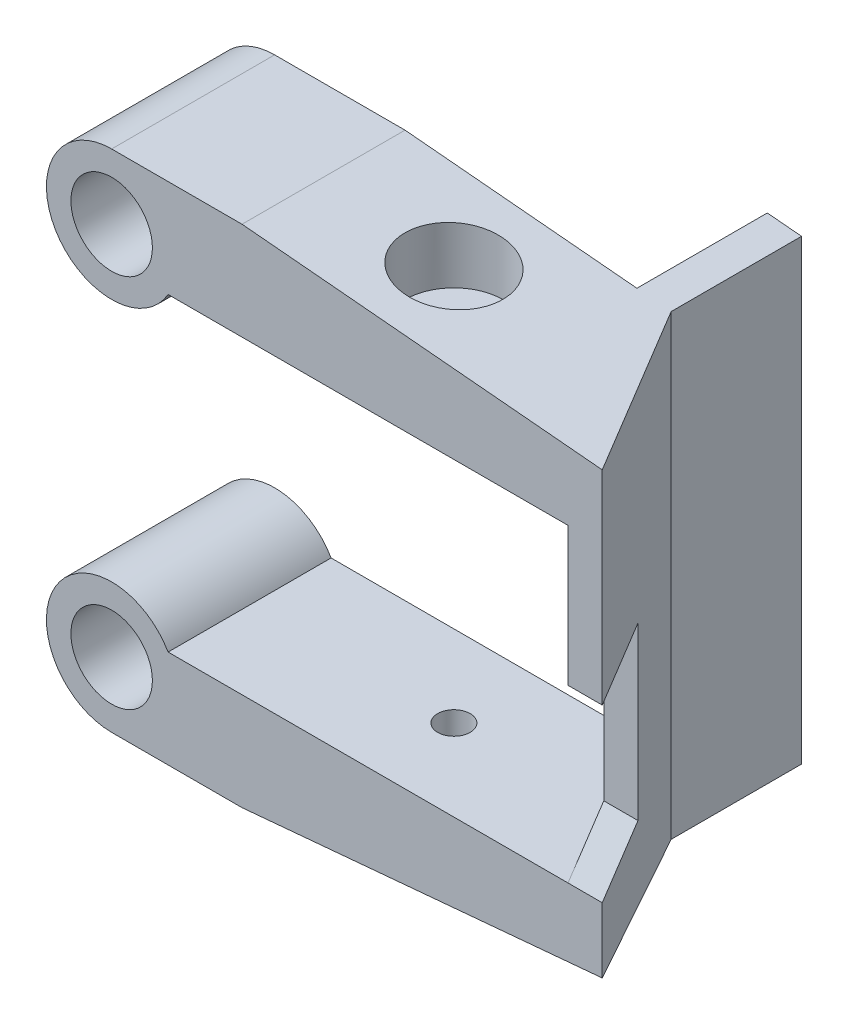
from build123d import *

# Parameters (mm, degrees)
CROQUIS1_R              = 2.5
SALIENTE_EXTRUIR1_DEPTH = 10
CROQUIS2_R              = 1
CORTAR_EXTRUIR1_DEPTH   = 4
CROQUIS3_R              = 3
CORTAR_EXTRUIR2_DEPTH   = 2
SALIENTE_EXTRUIR2_DEPTH = 13.5
SALIENTE_EXTRUIR3_START = 2
CROQUIS6_R              = 3
SALIENTE_EXTRUIR3_DEPTH = 2
CORTAR_EXTRUIR3_DEPTH   = 10
SALIENTE_EXTRUIR4_DEPTH = 8
CORTAR_EXTRUIR4_START   = 25.003066482
CORTAR_EXTRUIR4_DEPTH   = 5.096933518
CORTAR_EXTRUIR5_DEPTH   = 1


# Read off the part's stored shape, not the designer's step: Cortar-Extruir4
with BuildPart() as part:
    # Croquis1 → Saliente-Extruir1 (new body)
    with BuildSketch(Plane.XY):
        with BuildLine():
            Line((3.464101615, 3.5), (28, 3.5))
            Line((28, 3.5), (28, -0.5))
            Line((28, -0.5), (6, -0.5))
            Line((6, -0.5), (6, -2.5))
            Line((6, -2.5), (0, -2.5))
            ThreePointArc((0, -2.5), (-3.464101615, 3.5), (3.464101615, 3.5))
        make_face()
        with Locations((0, 1.5)):
            Circle(CROQUIS1_R, mode=Mode.SUBTRACT)
    extrude(amount=SALIENTE_EXTRUIR1_DEPTH)

    # Croquis2 → Cortar-Extruir1 (cut)
    with BuildSketch(Plane.XZ.offset(0.5)):
        with Locations(Location((16, 5, 0), (0, 0, 270))):
            Circle(CROQUIS2_R)
        Polygon((28, 10), (22.226497308, 0), (28, 0), align=None)
    extrude(amount=-CORTAR_EXTRUIR1_DEPTH, mode=Mode.SUBTRACT)

    # Croquis3 → Cortar-Extruir2 (cut)
    with BuildSketch(Plane.XZ.offset(0.5)):
        with Locations(Location((16, 5, 0), (0, 0, 270))):
            Circle(CROQUIS3_R)
    extrude(amount=-CORTAR_EXTRUIR2_DEPTH, mode=Mode.SUBTRACT)

    # Croquis4 → Saliente-Extruir2 (add)
    with BuildSketch(Plane.XZ.offset(0.5)):
        Polygon((28, 10), (30.1, 10), (24.326497308, 0), (22.226497308, 0), align=None)
    extrude(amount=-SALIENTE_EXTRUIR2_DEPTH)

    # Croquis6 → Saliente-Extruir3 (add)
    with BuildSketch(Plane.XZ.offset(0.5).offset(SALIENTE_EXTRUIR3_START)):
        Polygon((6, 10), (6, 0), (24.326497308, 0), (30.1, 10), align=None)
        with Locations(Location((16, 5, 0), (0, 0, 270))):
            Circle(CROQUIS6_R, mode=Mode.SUBTRACT)
    extrude(amount=-SALIENTE_EXTRUIR3_DEPTH)

    # Croquis7 → Cortar-Extruir3 (cut)
    with BuildSketch(Plane.XY.offset(10)):
        Polygon((30.1, -0.5), (8, -2.5), (30.1, -2.5), align=None)
    extrude(amount=-CORTAR_EXTRUIR3_DEPTH, mode=Mode.SUBTRACT)

    # Croquis8 → Saliente-Extruir4 (add)
    with BuildSketch(Plane(origin=(0, 0, 0), x_dir=(-1, 0, 0), z_dir=(0, 0, -1))):
        Polygon((-22.226497308, 13), (-24.326497308, 13), (-24.326497308, -1.022488931), (-22.226497308, -1.21253418), align=None)
    extrude(amount=SALIENTE_EXTRUIR4_DEPTH)

    # Simetría1: part across plane


with BuildPart() as part_1:
    add(part.part)
    add(part.part.mirror(Plane.ZX.offset(13)))

    # Cortar-Extruir4 outline → Cortar-Extruir4 (cut)
    with BuildSketch(Plane.YZ.offset(CORTAR_EXTRUIR4_START)):
        Polygon((3.771215703, 4.80915888), (14.271215703, 4.80915888), (14, 10), (3.5, 10), align=None)
    extrude(amount=CORTAR_EXTRUIR4_DEPTH, mode=Mode.SUBTRACT)

    # Croquis10 → Cortar-Extruir5 (cut)
    # profile 1 of 3: a face of its own
    with BuildSketch(Plane.XZ.offset(2.5)):
        with BuildLine():
            Line((0.93893851, 8.061465511), (0.624835946, 8.061465511))
            add(Edge.make_bspline(
                [(0.624835946, 8.061465511), (0.629974339, 8.091008734), (0.640098474, 8.149217504), (0.663168518, 8.233619406), (0.693890136, 8.31334783), (0.729855851, 8.389374725), (0.77397113, 8.460341308), (0.823569151, 8.527515757), (0.881199455, 8.589213597), (0.943781652, 8.647142725), (1.011267113, 8.699749333), (1.083372869, 8.74442066), (1.157885638, 8.783469404), (1.235775022, 8.815163541), (1.31697886, 8.838710682), (1.400592637, 8.85642678), (1.48740102, 8.867224), (1.54631294, 8.868506113), (1.576258221, 8.869157819)],
                knots=[0, 0, 0, 0, 1.053304757, 2.075317675, 3.068179183, 4.052514018, 5.025721787, 5.999656851, 6.981831287, 7.987213101, 8.994102963, 9.982949043, 10.963611807, 11.947192756, 12.931972798, 13.930523328, 14.948072636, 16, 16, 16, 16], degree=3))
            add(Edge.make_bspline(
                [(1.576258221, 8.869157819), (1.607849412, 8.868337596), (1.669858711, 8.866727609), (1.760664018, 8.85442526), (1.84726396, 8.835237206), (1.929477522, 8.806775963), (2.007089599, 8.770284416), (2.080961345, 8.72633159), (2.150619484, 8.674519652), (2.21443137, 8.614026389), (2.273438454, 8.548590787), (2.325098871, 8.477592336), (2.367371584, 8.401308099), (2.404054713, 8.321765516), (2.431060952, 8.236909756), (2.450848297, 8.147774097), (2.461883194, 8.05402824), (2.463669481, 7.990211824), (2.464579535, 7.957699485)],
                knots=[0, 0, 0, 0, 1.062315377, 2.085183558, 3.076853664, 4.041450855, 5.005054491, 5.956881831, 6.928532668, 7.918549963, 8.909565511, 9.889228988, 10.864308296, 11.838912148, 12.830831495, 13.853185998, 14.906269772, 16, 16, 16, 16], degree=3))
            add(Edge.make_bspline(
                [(2.464579535, 7.957699485), (2.463116795, 7.915300966), (2.460274509, 7.832915369), (2.437793048, 7.714206426), (2.399556512, 7.605209763), (2.354841164, 7.522096328), (2.310374191, 7.460727421), (2.271557279, 7.415828038), (2.227393375, 7.371636324), (2.177390877, 7.328856679), (2.121657913, 7.287495806), (2.060599984, 7.247148694), (1.99461627, 7.206562654), (1.947553936, 7.182191469), (1.92331351, 7.169638588)],
                knots=[0, 0, 0, 0, 1.499598844, 2.913907084, 4.255683563, 5.573052951, 6.236393449, 6.934250511, 7.671053759, 8.445154725, 9.260560518, 10.125260916, 11.034376938, 12, 12, 12, 12], degree=3))
            add(Edge.make_bspline(
                [(1.92331351, 7.169638588), (1.959233109, 7.145233398), (2.029395336, 7.097562418), (2.121912212, 7.013455328), (2.199538538, 6.921370005), (2.264524206, 6.822750081), (2.313572277, 6.715412989), (2.34974653, 6.60110216), (2.370969298, 6.478884654), (2.373528778, 6.394981352), (2.374835946, 6.352130575)],
                knots=[0, 0, 0, 0, 1.064624726, 2.079545519, 3.056122326, 4.013672591, 4.968126873, 5.942090367, 6.948992187, 8, 8, 8, 8], degree=3))
            add(Edge.make_bspline(
                [(2.374835946, 6.352130575), (2.372951048, 6.300812434), (2.36922834, 6.199458148), (2.339403877, 6.050347696), (2.290644048, 5.907158178), (2.223486846, 5.770520785), (2.138635562, 5.643878593), (2.038496205, 5.529007813), (1.922317264, 5.428948838), (1.792905422, 5.343764731), (1.653463441, 5.275250986), (1.506916129, 5.225768888), (1.354806806, 5.195153842), (1.251313153, 5.191510381), (1.199054696, 5.189670639)],
                knots=[0, 0, 0, 0, 1.004874671, 1.984646221, 2.966438109, 3.961709977, 4.958676373, 5.945134406, 6.938497793, 7.953256374, 8.973116323, 9.973725145, 10.976845487, 12, 12, 12, 12], degree=3))
            add(Edge.make_bspline(
                [(1.199054696, 5.189670639), (1.165832854, 5.190507601), (1.100573883, 5.192151679), (1.004559463, 5.204274263), (0.91247804, 5.224446776), (0.824180744, 5.253411912), (0.739975204, 5.290705099), (0.659339856, 5.335857332), (0.582972319, 5.389378235), (0.510561471, 5.450257408), (0.444148699, 5.518902365), (0.38427227, 5.594281029), (0.331495652, 5.67602942), (0.285883283, 5.764111158), (0.247186821, 5.858136921), (0.216630047, 5.958748464), (0.191662112, 6.065265565), (0.181374125, 6.13911863), (0.176117997, 6.176850126)],
                knots=[0, 0, 0, 0, 1.015592156, 1.994967694, 2.953714725, 3.89374535, 4.831137841, 5.76533834, 6.714853956, 7.678276274, 8.653576723, 9.630054425, 10.617115938, 11.623871201, 12.658910274, 13.721192194, 14.835758172, 16, 16, 16, 16], degree=3))
            Line((0.176117997, 6.176850126), (0.490220561, 6.176850126))
            add(Edge.make_bspline(
                [(0.490220561, 6.176850126), (0.497040066, 6.137680467), (0.509892115, 6.063861265), (0.538014089, 5.961531168), (0.570954337, 5.873556315), (0.611701031, 5.799048393), (0.661176422, 5.735216424), (0.719783483, 5.679156323), (0.788329897, 5.628889807), (0.864972279, 5.584979951), (0.947647633, 5.548083284), (1.034249656, 5.523879086), (1.122141028, 5.506036602), (1.181668268, 5.504531765), (1.211674888, 5.503773203)],
                knots=[0, 0, 0, 0, 1.310091687, 2.469000878, 3.493463796, 4.400459837, 5.257309936, 6.145490497, 7.065451012, 8.052643887, 9.053215749, 10.040649124, 11.012326184, 12, 12, 12, 12], degree=3))
            add(Edge.make_bspline(
                [(1.211674888, 5.503773203), (1.238597511, 5.504602376), (1.291773607, 5.506240114), (1.370450603, 5.518713672), (1.447016827, 5.538298922), (1.521916955, 5.565644483), (1.594356841, 5.602066821), (1.665280581, 5.645276658), (1.733536607, 5.697299459), (1.799494815, 5.755319564), (1.860068549, 5.818798356), (1.913814327, 5.884758638), (1.958972289, 5.952665305), (1.996883838, 6.021985519), (2.024341568, 6.094237738), (2.046210619, 6.167129776), (2.058116823, 6.242365936), (2.059856347, 6.292965433), (2.060733382, 6.318476729)],
                knots=[0, 0, 0, 0, 0.998765887, 1.972707914, 2.948771611, 3.928374012, 4.925217491, 5.953083336, 7.006002037, 8.105848567, 9.210029586, 10.258437752, 11.259122355, 12.233064382, 13.183315866, 14.122098927, 15.053198292, 16, 16, 16, 16], degree=3))
            add(Edge.make_bspline(
                [(2.060733382, 6.318476729), (2.059522921, 6.351280565), (2.057124568, 6.416276664), (2.037890817, 6.511589386), (2.004915129, 6.602440739), (1.960253791, 6.688491257), (1.903835241, 6.768053519), (1.834684637, 6.83724714), (1.755246554, 6.897149426), (1.663368987, 6.945702691), (1.55864559, 6.983705207), (1.439986475, 7.01058645), (1.306519998, 7.026430341), (1.21265571, 7.028385903), (1.163297484, 7.029414229)],
                knots=[0, 0, 0, 0, 0.91172544, 1.806453237, 2.690400502, 3.591501907, 4.495060705, 5.391179975, 6.301027311, 7.251780241, 8.269539355, 9.39038931, 10.627744823, 12, 12, 12, 12], degree=3))
            Line((1.163297484, 7.029414229), (1.201158061, 7.343516793))
            Line((1.201158061, 7.343516793), (1.293706138, 7.340712306))
            add(Edge.make_bspline(
                [(1.293706138, 7.340712306), (1.324811868, 7.341178226), (1.385761775, 7.342091169), (1.475077644, 7.35138343), (1.559901485, 7.366738652), (1.640108279, 7.387741218), (1.715622717, 7.414220123), (1.786280526, 7.44743607), (1.852291997, 7.486939984), (1.913684775, 7.531369364), (1.968915048, 7.580397423), (2.017506686, 7.632116807), (2.058591616, 7.686673267), (2.092526981, 7.743112995), (2.117845607, 7.80253954), (2.137066983, 7.863471046), (2.148690203, 7.927343696), (2.149875586, 7.970739426), (2.150476971, 7.992755575)],
                knots=[0, 0, 0, 0, 1.24628212, 2.442018811, 3.593922291, 4.698034728, 5.761554064, 6.796478033, 7.821307851, 8.840472263, 9.829094753, 10.776759556, 11.679673515, 12.561550013, 13.408929098, 14.262137482, 15.118322481, 16, 16, 16, 16], degree=3))
            add(Edge.make_bspline(
                [(2.150476971, 7.992755575), (2.149879643, 8.012172686), (2.148708953, 8.050227808), (2.141207508, 8.106314914), (2.126751398, 8.159707011), (2.107933167, 8.210950127), (2.084015792, 8.260171058), (2.05339587, 8.306215709), (2.018256976, 8.350816229), (1.977717433, 8.39245815), (1.933515781, 8.430681976), (1.886143137, 8.463770969), (1.836720561, 8.492121465), (1.784693356, 8.515504162), (1.729560582, 8.53290078), (1.672056357, 8.545412394), (1.61223344, 8.553350819), (1.571608636, 8.554481942), (1.551017837, 8.555055255)],
                knots=[0, 0, 0, 0, 1.017722485, 1.994609554, 2.957110515, 3.910372255, 4.852475095, 5.817233168, 6.802300924, 7.824362143, 8.857880086, 9.860231714, 10.847656914, 11.840006958, 12.84318132, 13.87138813, 14.921106966, 16, 16, 16, 16], degree=3))
            add(Edge.make_bspline(
                [(1.551017837, 8.555055255), (1.513243587, 8.553522788), (1.439376671, 8.550526074), (1.332798148, 8.524553384), (1.234376121, 8.481877703), (1.145539315, 8.423108063), (1.068727227, 8.350229513), (1.007322387, 8.26475368), (0.962853522, 8.167415855), (0.947042682, 8.097369313), (0.93893851, 8.061465511)],
                knots=[0, 0, 0, 0, 1.055739269, 2.064480543, 3.048501583, 4.044208126, 5.029380081, 5.994799901, 6.972193286, 8, 8, 8, 8], degree=3))
        make_face()
    # profile 2 of 3: a face of its own
    with BuildSketch(Plane.XZ.offset(2.5)):
        with BuildLine():
            add(Edge.make_bspline(
                [(4.355505016, 8.869157819), (4.388059863, 8.868069527), (4.452174428, 8.865926212), (4.546084688, 8.849259248), (4.636114186, 8.822600306), (4.721893143, 8.784634397), (4.80325974, 8.735154132), (4.881575795, 8.676542088), (4.954406772, 8.605227358), (5.023833004, 8.525051913), (5.087046416, 8.434618584), (5.14158594, 8.334205801), (5.18891997, 8.225299094), (5.226405985, 8.106766331), (5.255694149, 7.979663836), (5.276533299, 7.843513602), (5.289236946, 7.698527531), (5.290734177, 7.598751842), (5.291502612, 7.547543235)],
                knots=[0, 0, 0, 0, 0.862726717, 1.699081786, 2.520498053, 3.347202637, 4.178215295, 5.040763974, 5.93476699, 6.875030527, 7.849681161, 8.853576535, 9.899908318, 10.99336013, 12.144709661, 13.354978701, 14.642476391, 16, 16, 16, 16], degree=3))
            add(Edge.make_bspline(
                [(5.291502612, 7.547543235), (5.290873113, 7.48792938), (5.289630393, 7.370243338), (5.27844128, 7.196036781), (5.262390013, 7.026314147), (5.237343526, 6.861506232), (5.206768114, 6.701159816), (5.168931348, 6.545532105), (5.124141942, 6.394545984), (5.072313538, 6.249432554), (5.015983852, 6.112062685), (4.957281718, 5.983483243), (4.89474633, 5.866042629), (4.830722298, 5.757890303), (4.762162722, 5.661295934), (4.69274256, 5.573424163), (4.618471791, 5.497715654), (4.542605395, 5.431205347), (4.46425206, 5.374453633), (4.384960754, 5.324927813), (4.30402141, 5.283826665), (4.222455101, 5.248523157), (4.138565768, 5.222972575), (4.053718339, 5.204137373), (3.96747482, 5.191253787), (3.909404353, 5.190201071), (3.880144439, 5.189670639)],
                knots=[0, 0, 0, 0, 1.417840176, 2.799013713, 4.150912842, 5.471708405, 6.7625667, 8.032669517, 9.279703417, 10.506991142, 11.696233478, 12.810550062, 13.867435083, 14.859899853, 15.797607937, 16.683162267, 17.520520521, 18.316460938, 19.08034531, 19.819286053, 20.537807717, 21.237833669, 21.930604121, 22.619796651, 23.304558187, 24, 24, 24, 24], degree=3))
            add(Edge.make_bspline(
                [(3.880144439, 5.189670639), (3.836998162, 5.1913878), (3.752421184, 5.194753846), (3.629647003, 5.222286862), (3.514709871, 5.266793382), (3.425784602, 5.318432914), (3.359981415, 5.368653827), (3.312593927, 5.410839063), (3.268567491, 5.458209249), (3.22646348, 5.509514173), (3.186183674, 5.564950328), (3.149190381, 5.625679866), (3.114157939, 5.690674589), (3.081900383, 5.760453989), (3.052075978, 5.834856148), (3.027110654, 5.91485138), (3.006160797, 6.000141255), (2.9888237, 6.090494726), (2.974689216, 6.185903482), (2.964989903, 6.286522468), (2.95949358, 6.39249974), (2.958618066, 6.465004749), (2.958169279, 6.502170639)],
                knots=[0, 0, 0, 0, 1.435486142, 2.813894703, 4.16658029, 5.526677663, 6.22086169, 6.92078, 7.636484549, 8.371846828, 9.129958256, 9.916110108, 10.737818826, 11.587357994, 12.474660306, 13.405010476, 14.375161658, 15.397738152, 16.467494513, 17.58566334, 18.762416952, 20, 20, 20, 20], degree=3))
            add(Edge.make_bspline(
                [(2.958169279, 6.502170639), (2.958865674, 6.564116822), (2.960235698, 6.685984109), (2.970360627, 6.865826051), (2.986109, 7.039663223), (3.009073804, 7.207455853), (3.03967935, 7.368932488), (3.074965111, 7.524963437), (3.11761059, 7.675059131), (3.167466978, 7.818273174), (3.221759595, 7.953407837), (3.279380444, 8.079604938), (3.339910015, 8.196032674), (3.404482116, 8.302030016), (3.471833081, 8.398126528), (3.54278095, 8.483796956), (3.616461422, 8.560222791), (3.693787229, 8.626268002), (3.773613724, 8.682691864), (3.853281045, 8.733323779), (3.935141247, 8.77435652), (4.017171393, 8.809121265), (4.100426795, 8.836103417), (4.184753616, 8.854619434), (4.269805581, 8.867523895), (4.32694524, 8.868613305), (4.355505016, 8.869157819)],
                knots=[0, 0, 0, 0, 1.470791388, 2.893501234, 4.275600723, 5.614434664, 6.912857095, 8.17686219, 9.411686231, 10.615561684, 11.775855534, 12.868421853, 13.908428417, 14.889627493, 15.813393228, 16.692284126, 17.528148069, 18.331072678, 19.102586731, 19.8478506, 20.570031765, 21.273923614, 21.961841481, 22.644389209, 23.322433117, 24, 24, 24, 24], degree=3))
        make_face()
        with BuildLine():
            add(Edge.make_bspline(
                [(4.331666875, 8.555055255), (4.312692399, 8.554335183), (4.274498697, 8.552885752), (4.216987949, 8.542346785), (4.158617191, 8.526407312), (4.099329033, 8.50278295), (4.039549291, 8.472560878), (3.978520016, 8.436429583), (3.916971319, 8.393478294), (3.854524929, 8.344050338), (3.793356503, 8.286295246), (3.734454584, 8.220191684), (3.678121663, 8.145430069), (3.625035999, 8.061429946), (3.57377385, 7.968829499), (3.525719425, 7.867042696), (3.48020083, 7.756795691), (3.43764131, 7.638419264), (3.398295246, 7.512994087), (3.364946719, 7.380647543), (3.335978434, 7.242703344), (3.313470063, 7.098450591), (3.293857729, 6.948697019), (3.281987693, 6.792820217), (3.273919754, 6.631262547), (3.272827948, 6.521579004), (3.272271843, 6.465712306)],
                knots=[0, 0, 0, 0, 0.535590216, 1.078088953, 1.646503504, 2.242120821, 2.876684528, 3.536551845, 4.243209066, 4.994585865, 5.783597611, 6.615574094, 7.492013341, 8.4238755, 9.419375135, 10.479150357, 11.600588305, 12.786362483, 14.030464638, 15.311003394, 16.63899601, 18.009344201, 19.432868756, 20.902802065, 22.422459604, 24, 24, 24, 24], degree=3))
            add(Edge.make_bspline(
                [(3.272271843, 6.465712306), (3.272737165, 6.426195177), (3.273635908, 6.349870101), (3.282582447, 6.23923113), (3.294951715, 6.136228248), (3.314964073, 6.041478117), (3.339059573, 5.954189748), (3.369950634, 5.875211985), (3.405592361, 5.803505356), (3.447166989, 5.740266455), (3.492787274, 5.684797454), (3.541462394, 5.636638548), (3.592815964, 5.595897175), (3.646321147, 5.561633529), (3.702919027, 5.535391686), (3.762418731, 5.517347512), (3.824288709, 5.505546373), (3.866535277, 5.504367946), (3.887856779, 5.503773203)],
                knots=[0, 0, 0, 0, 1.484932994, 2.868063245, 4.170070992, 5.381165891, 6.504504114, 7.56970386, 8.563591869, 9.508896032, 10.407542569, 11.258515368, 12.077514383, 12.867109075, 13.641358872, 14.41376278, 15.199438864, 16, 16, 16, 16], degree=3))
            add(Edge.make_bspline(
                [(3.887856779, 5.503773203), (3.910105066, 5.504400054), (3.954653206, 5.505655208), (4.021012901, 5.517376097), (4.086453159, 5.536537197), (4.151244324, 5.562665455), (4.215518334, 5.596034703), (4.279351618, 5.636543931), (4.34169406, 5.685770608), (4.4040879, 5.74066751), (4.4643629, 5.80324407), (4.52172075, 5.872652307), (4.575797961, 5.948599354), (4.626153878, 6.031065088), (4.673958733, 6.119396622), (4.718004593, 6.214288529), (4.758863059, 6.315660137), (4.782827145, 6.386128677), (4.795108382, 6.422242755)],
                knots=[0, 0, 0, 0, 0.77604706, 1.553892808, 2.343877876, 3.152800139, 3.98830987, 4.868615572, 5.78728157, 6.75807329, 7.767676272, 8.816335789, 9.898351881, 11.019038633, 12.187032868, 13.402327443, 14.668731489, 16, 16, 16, 16], degree=3))
            add(Edge.make_bspline(
                [(4.795108382, 6.422242755), (4.809760777, 6.468632726), (4.839182801, 6.56178383), (4.87622479, 6.704026353), (4.906626079, 6.848757551), (4.933236689, 6.995453295), (4.952164185, 7.144836257), (4.967391568, 7.29628087), (4.975752044, 7.450225296), (4.976847653, 7.553610513), (4.977400048, 7.605736344)],
                knots=[0, 0, 0, 0, 0.97088093, 1.949529747, 2.93210591, 3.92216045, 4.924261898, 5.936559817, 6.959633308, 8, 8, 8, 8], degree=3))
            add(Edge.make_bspline(
                [(4.977400048, 7.605736344), (4.976883019, 7.644078768), (4.975882302, 7.718291053), (4.967593179, 7.826048559), (4.952967779, 7.926295192), (4.932719933, 8.019356512), (4.907033544, 8.105070908), (4.875524477, 8.183325642), (4.838305805, 8.254315485), (4.794785694, 8.317270339), (4.746855468, 8.372765819), (4.696212, 8.421429327), (4.64311105, 8.46335816), (4.586208523, 8.496401556), (4.52678098, 8.522765371), (4.464401297, 8.541569265), (4.398950746, 8.553328917), (4.354387061, 8.554472311), (4.331666875, 8.555055255)],
                knots=[0, 0, 0, 0, 1.430250887, 2.768270117, 4.028380119, 5.206661668, 6.318152812, 7.362403216, 8.349129852, 9.30195703, 10.210727286, 11.080171321, 11.919002126, 12.727940788, 13.528188044, 14.339050687, 15.153187666, 16, 16, 16, 16], degree=3))
        make_face(mode=Mode.SUBTRACT)
    # profile 3 of 3: a face of its own
    with BuildSketch(Plane.XZ.offset(2.5)):
        with BuildLine():
            add(Edge.make_bspline(
                [(6.539499407, 8.869157819), (6.562901292, 8.868430082), (6.609209602, 8.866990016), (6.67719874, 8.857195769), (6.742362302, 8.840305806), (6.804285148, 8.81618024), (6.863816543, 8.78578802), (6.920447327, 8.748640689), (6.974287912, 8.70472453), (7.024106434, 8.654334892), (7.070815613, 8.599402935), (7.110336265, 8.538662177), (7.145367844, 8.474508352), (7.173287951, 8.405826271), (7.194185464, 8.332847425), (7.209501625, 8.255941945), (7.219818834, 8.174858368), (7.22059488, 8.119223825), (7.220989792, 8.090912626)],
                knots=[0, 0, 0, 0, 0.970717871, 1.920883944, 2.842680434, 3.757311267, 4.672198984, 5.610669493, 6.561577208, 7.54876171, 8.546788736, 9.547073532, 10.549095219, 11.575307918, 12.615394826, 13.693467145, 14.826256018, 16, 16, 16, 16], degree=3))
            add(Edge.make_bspline(
                [(7.220989792, 8.090912626), (7.220481139, 8.057917544), (7.219485517, 7.993333952), (7.206840849, 7.898874959), (7.188063495, 7.808818583), (7.162358919, 7.722620827), (7.127885768, 7.641117782), (7.085334499, 7.564393081), (7.036336637, 7.491679995), (6.979574649, 7.424806923), (6.917492356, 7.364148365), (6.851572933, 7.310432199), (6.781461125, 7.265157537), (6.707906243, 7.228018803), (6.630646214, 7.198787465), (6.5499205, 7.178717749), (6.465554509, 7.166479371), (6.408197797, 7.164857078), (6.378942516, 7.164029614)],
                knots=[0, 0, 0, 0, 1.130854088, 2.213500164, 3.262022406, 4.283858738, 5.293169922, 6.29044296, 7.288617459, 8.29537939, 9.292942272, 10.261820963, 11.206697579, 12.149430033, 13.082848615, 14.033453143, 14.996945993, 16, 16, 16, 16], degree=3))
            add(Edge.make_bspline(
                [(6.378942516, 7.164029614), (6.355066135, 7.164711291), (6.30827602, 7.166047161), (6.239513864, 7.176350467), (6.173540384, 7.19203012), (6.110513784, 7.215469228), (6.051070915, 7.245804863), (5.994126118, 7.282029391), (5.940058126, 7.324747023), (5.890076866, 7.374394799), (5.844470178, 7.429049864), (5.804268568, 7.488077268), (5.770416902, 7.551547232), (5.743341577, 7.619178098), (5.721347839, 7.690154338), (5.705961669, 7.765275914), (5.696746811, 7.844351273), (5.695820538, 7.898546249), (5.695348766, 7.926149005)],
                knots=[0, 0, 0, 0, 0.998939331, 1.957603429, 2.904214697, 3.832710991, 4.764499105, 5.69253155, 6.653438724, 7.642559757, 8.635735374, 9.628718291, 10.626459594, 11.640042448, 12.673490826, 13.732455774, 14.845087277, 16, 16, 16, 16], degree=3))
            add(Edge.make_bspline(
                [(5.695348766, 7.926149005), (5.69624365, 7.959364854), (5.697994495, 8.024351815), (5.709195351, 8.119917885), (5.728710434, 8.211008923), (5.75642696, 8.297674476), (5.790545556, 8.380469207), (5.833757367, 8.458479372), (5.884449177, 8.532448244), (5.942324561, 8.601385916), (6.005632215, 8.663835623), (6.072228079, 8.719328786), (6.143042686, 8.764795742), (6.216061279, 8.803105674), (6.292463505, 8.832859368), (6.371969462, 8.853740013), (6.454696344, 8.866858279), (6.510937802, 8.868383336), (6.539499407, 8.869157819)],
                knots=[0, 0, 0, 0, 1.130922342, 2.21265473, 3.270805013, 4.297553847, 5.306888354, 6.314716204, 7.327776304, 8.355757729, 9.374178632, 10.352259942, 11.301297143, 12.233743801, 13.155811409, 14.086116658, 15.028055401, 16, 16, 16, 16], degree=3))
        make_face()
        with BuildLine():
            add(Edge.make_bspline(
                [(6.527580337, 8.599927049), (6.503420208, 8.599060007), (6.45529798, 8.597333028), (6.38403284, 8.580863396), (6.314336182, 8.55499144), (6.247374229, 8.518241337), (6.184233771, 8.473312351), (6.12819621, 8.418117548), (6.078651414, 8.354758719), (6.037881685, 8.282434451), (6.004787896, 8.204172975), (5.981710087, 8.120249677), (5.967430662, 8.031806516), (5.965541084, 7.971075577), (5.964579535, 7.94017144)],
                knots=[0, 0, 0, 0, 0.898823508, 1.790279833, 2.710439412, 3.660988812, 4.627551506, 5.588017192, 6.580694835, 7.614151002, 8.671642138, 9.738410943, 10.84914581, 12, 12, 12, 12], degree=3))
            add(Edge.make_bspline(
                [(5.964579535, 7.94017144), (5.965946256, 7.90359121), (5.968570013, 7.833366439), (5.991679975, 7.733483893), (6.031698991, 7.645600407), (6.085604078, 7.569804805), (6.152551126, 7.509449084), (6.22836915, 7.464568641), (6.313134342, 7.437606707), (6.37243858, 7.434731458), (6.402780657, 7.433260383)],
                knots=[0, 0, 0, 0, 1.167761783, 2.24180663, 3.250972385, 4.235329223, 5.192198183, 6.109164403, 7.032583837, 8, 8, 8, 8], degree=3))
            add(Edge.make_bspline(
                [(6.402780657, 7.433260383), (6.422916428, 7.433712295), (6.462239244, 7.434594827), (6.5198903, 7.444091236), (6.574404077, 7.45947391), (6.626204206, 7.480404108), (6.67444685, 7.508450095), (6.719924454, 7.541964387), (6.762466183, 7.581765166), (6.801206955, 7.627262478), (6.836627796, 7.676513482), (6.867785723, 7.728730421), (6.89389251, 7.783652587), (6.914478958, 7.841135077), (6.931831924, 7.900483637), (6.943541308, 7.962459707), (6.950742447, 8.026937132), (6.95141716, 8.07079445), (6.951759023, 8.093015992)],
                knots=[0, 0, 0, 0, 1.007750251, 1.968018882, 2.916659645, 3.840494567, 4.758079246, 5.703899357, 6.664595947, 7.668873183, 8.692139613, 9.699889865, 10.710423493, 11.732484109, 12.755080818, 13.804198226, 14.88743536, 16, 16, 16, 16], degree=3))
            add(Edge.make_bspline(
                [(6.951759023, 8.093015992), (6.950463841, 8.130320179), (6.947991878, 8.201518368), (6.924332546, 8.301877862), (6.886601963, 8.390704058), (6.832015802, 8.46477426), (6.767562372, 8.524948143), (6.694509431, 8.569184545), (6.613214978, 8.595361151), (6.556514492, 8.598384328), (6.527580337, 8.599927049)],
                knots=[0, 0, 0, 0, 1.207628711, 2.304861276, 3.322697533, 4.315405203, 5.264472711, 6.164993415, 7.063599473, 8, 8, 8, 8], degree=3))
        make_face(mode=Mode.SUBTRACT)
    extrude(amount=-CORTAR_EXTRUIR5_DEPTH, mode=Mode.SUBTRACT)


solid = part_1.part
